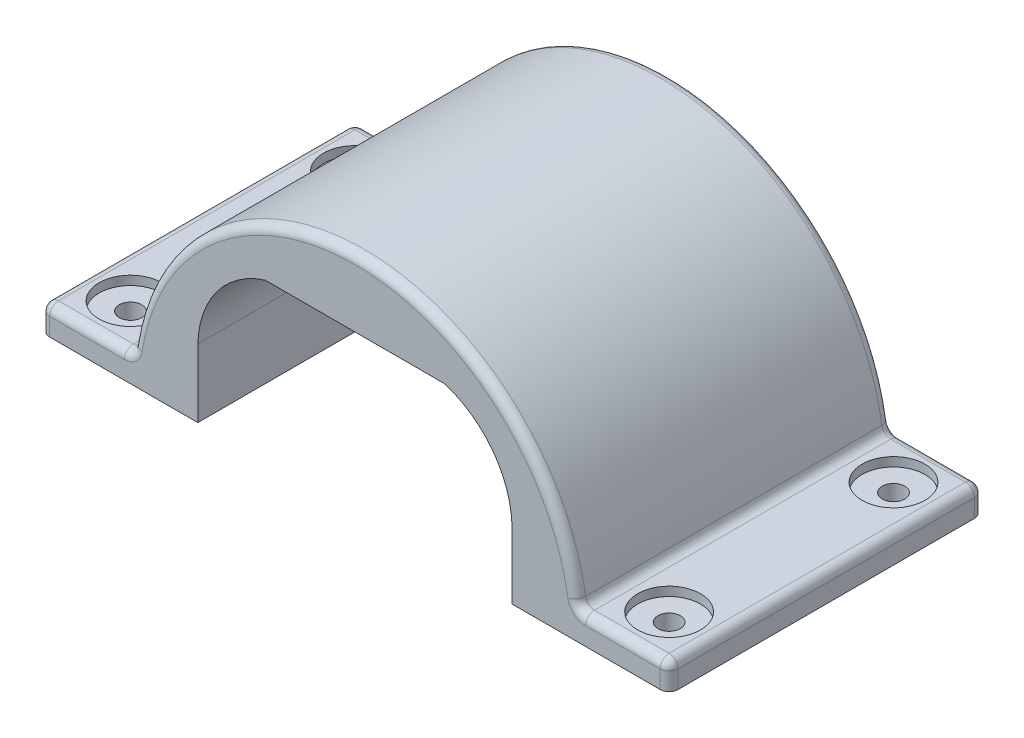
from build123d import *

# Parameters (mm, degrees)
CROQUIS1_W              = 70
CROQUIS1_H              = 35
SALIENTE_EXTRUIR1_DEPTH = 30
CORTAR_EXTRUIR1_DEPTH   = 310
CORTAR_EXTRUIR2_DEPTH   = 310
CROQUIS4_R              = 3.5
CORTAR_EXTRUIR3_DEPTH   = 1
REDONDEO1_R             = 1
REDONDEO2_R             = 1
CROQUIS5_R              = 1.25
CORTAR_EXTRUIR4_DEPTH   = 10


with BuildPart() as part:
    # Croquis1 → Saliente-Extruir1 (new body)
    with BuildSketch(Plane(origin=(0, 0, 0), x_dir=(1, 0, 0), z_dir=(0, 1, 0))):
        with Locations((1.719890136, -31.459853515)):
            Rectangle(CROQUIS1_W, CROQUIS1_H)
    extrude(amount=SALIENTE_EXTRUIR1_DEPTH)

    # Croquis2 → Cortar-Extruir1 (cut)
    with BuildSketch(Plane.XY.offset(48.959853515)):
        with BuildLine():
            Line((-15.780109864, 0), (-15.780109864, 7.596564782))
            ThreePointArc((-15.780109864, 7.596564782), (-13.616336365, 13.749552304), (-8.280109864, 17.5))
            Line((-8.280109864, 17.5), (11.719890136, 17.5))
            ThreePointArc((11.719890136, 17.5), (17.0561195, 13.749554472), (19.219890136, 7.596564782))
            Line((19.219890136, 7.596564782), (19.219890136, 0))
            ThreePointArc((19.219890136, 0), (1.719890136, -17.5), (-15.780109864, 0))
        make_face()
    extrude(amount=-CORTAR_EXTRUIR1_DEPTH, mode=Mode.SUBTRACT)

    # Croquis3 → Cortar-Extruir2 (cut)
    with BuildSketch(Plane.XY.offset(48.959853515)):
        with BuildLine():
            Line((-33.280109864, 30), (36.719890136, 30))
            Line((36.719890136, 30), (36.719890136, 3))
            Line((36.719890136, 3), (26.539237428, 3))
            ThreePointArc((26.539237428, 3), (1.719890136, 25), (-23.099457156, 3))
            Line((-23.099457156, 3), (-33.280109864, 3))
            Line((-33.280109864, 3), (-33.280109864, 30))
        make_face()
    extrude(amount=-CORTAR_EXTRUIR2_DEPTH, mode=Mode.SUBTRACT)

    # Croquis4 → Cortar-Extruir3 (cut)
    with BuildSketch(Plane(origin=(0, 3, 0), x_dir=(1, 0, 0), z_dir=(0, 1, 0))):
        with Locations(Location((-28.280109864, -18.959853515, 0), (0, 0, 180))):
            Circle(CROQUIS4_R)
        with Locations(Location((-28.280109864, -43.959853515, 0), (0, 0, 180))):
            Circle(CROQUIS4_R)
        with Locations(Location((31.719890136, -18.959853515, 0), (0, 0, 180))):
            Circle(CROQUIS4_R)
        with Locations(Location((31.719890136, -43.959853515, 0), (0, 0, 180))):
            Circle(CROQUIS4_R)
    extrude(amount=-CORTAR_EXTRUIR3_DEPTH, mode=Mode.SUBTRACT)

    # Redondeo1
    redondeo1_edges = [part.edges().sort_by_distance(p)[0] for p in [
        (-28.18978351, 3, 13.959853515),
        (1.719890136, 25, 13.959853515),
        (31.629563782, 3, 13.959853515),
        (36.719890136, 3, 31.459853515),
        (26.539237428, 3, 31.459853515),
        (-23.099457156, 3, 31.459853515),
        (-33.280109864, 3, 31.459853515),
        (-28.18978351, 3, 48.959853515),
        (1.719890136, 25, 48.959853515),
        (31.629563782, 3, 48.959853515),
    ]]
    fillet(redondeo1_edges, radius=REDONDEO1_R)

    # Redondeo2
    # the kernel refuses this fillet: 1 mm, written as the material it takes off along each edge
    with BuildSketch(Plane(origin=(-32.280109864, 2, 14.959853515), x_dir=(-1, 0, 0), z_dir=(0, 0, -1))) as redondeo2_piece_1_section:
        Polygon((0, 0), (REDONDEO2_R, 0), (REDONDEO2_R, REDONDEO2_R), (0, REDONDEO2_R), align=None)
    redondeo2_piece_1 = extrude(amount=REDONDEO2_R, mode=Mode.PRIVATE)
    redondeo2_piece_1 = redondeo2_piece_1 - Plane(origin=(-32.280109864, 2, 14.959853515), x_dir=(0.7071067811865475, -0.7071067811865475, 0), z_dir=(0, 0, -1)) * Sphere(REDONDEO2_R, mode=Mode.PRIVATE)
    add(redondeo2_piece_1, mode=Mode.SUBTRACT)
    with BuildSketch(Plane(origin=(35.719890136, 2, 14.959853515), x_dir=(1, 0, 0), z_dir=(0, 0, -1))) as redondeo2_piece_2_section:
        Polygon((0, 0), (REDONDEO2_R, 0), (REDONDEO2_R, -REDONDEO2_R), (0, -REDONDEO2_R), align=None)
    redondeo2_piece_2 = extrude(amount=REDONDEO2_R, mode=Mode.PRIVATE)
    redondeo2_piece_2 = redondeo2_piece_2 - Plane(origin=(35.719890136, 2, 14.959853515), x_dir=(-0.7071067811865475, -0.7071067811865475, 0), z_dir=(0, 0, -1)) * Sphere(REDONDEO2_R, mode=Mode.PRIVATE)
    add(redondeo2_piece_2, mode=Mode.SUBTRACT)
    with BuildSketch(Plane(origin=(-32.280109864, 2, 47.959853515), x_dir=(0, 0, 1), z_dir=(-1, 0, 0))) as redondeo2_piece_3_section:
        Polygon((0, 0), (REDONDEO2_R, 0), (REDONDEO2_R, REDONDEO2_R), (0, REDONDEO2_R), align=None)
    redondeo2_piece_3 = extrude(amount=REDONDEO2_R, mode=Mode.PRIVATE)
    redondeo2_piece_3 = redondeo2_piece_3 - Plane(origin=(-32.280109864, 2, 47.959853515), x_dir=(0, -0.7071067811865475, -0.7071067811865475), z_dir=(-1, 0, 0)) * Sphere(REDONDEO2_R, mode=Mode.PRIVATE)
    add(redondeo2_piece_3, mode=Mode.SUBTRACT)
    with BuildSketch(Plane(origin=(35.719890136, 2, 47.959853515), x_dir=(0, 0, 1), z_dir=(1, 0, 0))) as redondeo2_piece_4_section:
        Polygon((0, 0), (REDONDEO2_R, 0), (REDONDEO2_R, -REDONDEO2_R), (0, -REDONDEO2_R), align=None)
    redondeo2_piece_4 = extrude(amount=REDONDEO2_R, mode=Mode.PRIVATE)
    redondeo2_piece_4 = redondeo2_piece_4 - Plane(origin=(35.719890136, 2, 47.959853515), x_dir=(0, -0.7071067811865475, -0.7071067811865475), z_dir=(1, 0, 0)) * Sphere(REDONDEO2_R, mode=Mode.PRIVATE)
    add(redondeo2_piece_4, mode=Mode.SUBTRACT)
    with BuildSketch(Plane(origin=(36.719890136, -2.5, 48.959853515), x_dir=(0, 0, -1), z_dir=(0, 1, 0)), Plane(origin=(36.719890136, -2.5, 13.959853515), x_dir=(-1, 0, 0), z_dir=(0, 1, 0))) as redondeo2_piece_5:
        with BuildLine():
            CenterArc((REDONDEO2_R, REDONDEO2_R), REDONDEO2_R, 180, 90)
            Line((0, REDONDEO2_R), (0, 0))
            Line((0, 0), (REDONDEO2_R, 0))
        make_face()
    extrude(amount=4.5, mode=Mode.SUBTRACT)
    with BuildSketch(Plane(origin=(-33.280109864, -2.5, 48.959853515), x_dir=(0, 0, -1), z_dir=(0, 1, 0)), Plane(origin=(-33.280109864, -2.5, 13.959853515), x_dir=(1, 0, 0), z_dir=(0, 1, 0))) as redondeo2_piece_6:
        with BuildLine():
            CenterArc((REDONDEO2_R, -REDONDEO2_R), REDONDEO2_R, 90, 90)
            Line((0, -REDONDEO2_R), (0, 0))
            Line((0, 0), (REDONDEO2_R, 0))
        make_face()
    extrude(amount=4.5, mode=Mode.SUBTRACT)

    # Croquis5 → Cortar-Extruir4 (cut)
    with BuildSketch(Plane(origin=(0, 2, 0), x_dir=(1, 0, 0), z_dir=(0, 1, 0))):
        with Locations(Location((-28.280109864, -18.959853515, 0), (0, 0, 180))):
            Circle(CROQUIS5_R)
        with Locations(Location((31.719890136, -18.959853515, 0), (0, 0, 180))):
            Circle(CROQUIS5_R)
        with Locations(Location((31.719890136, -43.959853515, 0), (0, 0, 180))):
            Circle(CROQUIS5_R)
        with Locations(Location((-28.280109864, -43.959853515, 0), (0, 0, 180))):
            Circle(CROQUIS5_R)
    extrude(amount=-CORTAR_EXTRUIR4_DEPTH, mode=Mode.SUBTRACT)


solid = part.part
